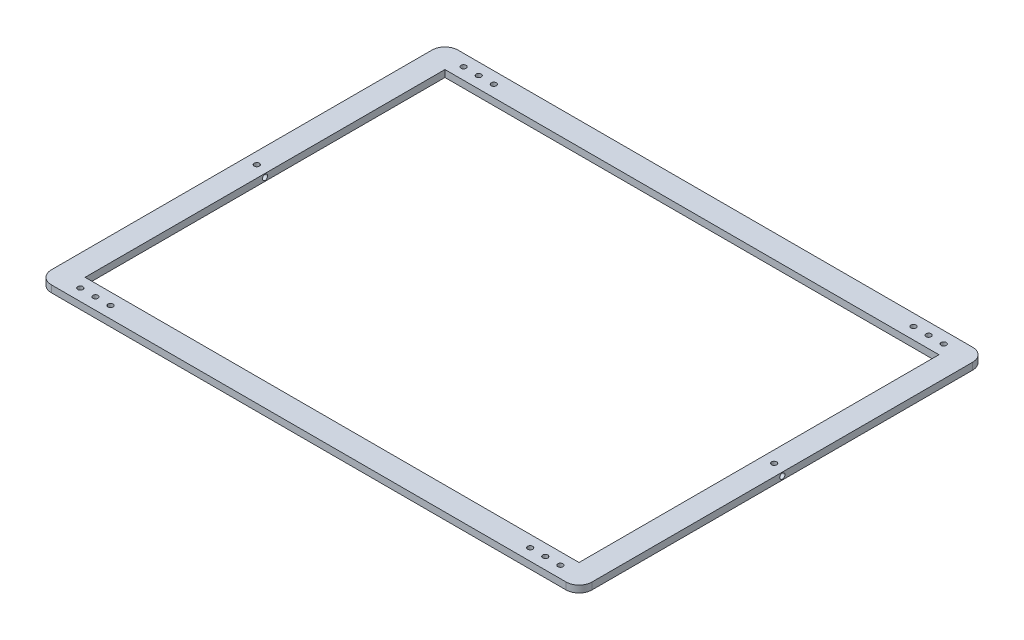
from build123d import *

# Parameters (mm, degrees)
SKETCH_1_W               = 625
SKETCH_1_H               = 470
SKETCH_1_W_2             = 571
SKETCH_1_H_2             = 416
EXTRUDE_1_DEPTH          = 4
FILLET_1_R               = 15
SKETCH_2_R               = 3
CUT_EXTRUDE_1_DEPTH      = 392.082152495
CUT_EXTRUDE_2_DEPTH      = 392.020779499
CUT_EXTRUDE_2_DEPTH_BACK = 392.020779499
SKETCH_3_R               = 3
SKETCH_4_R               = 3
CUT_EXTRUDE_3_DEPTH      = 392.082152495


with BuildPart() as part:
    # Эскиз1 → Бобышка-Вытянуть1 (new, symmetric)
    with BuildSketch(Plane(origin=(0, 0, 0), x_dir=(1, 0, 0), z_dir=(0, 1, 0))):
        Rectangle(SKETCH_1_W, SKETCH_1_H)
        Rectangle(SKETCH_1_W_2, SKETCH_1_H_2, mode=Mode.SUBTRACT)
    extrude(amount=EXTRUDE_1_DEPTH, both=True)

    # Скругление1
    fillet_1_edges = [part.edges().sort_by_distance(p)[0] for p in [
        (312.5, 0, 235),
        (-312.5, 0, 235),
        (312.5, 0, -235),
        (-312.5, 0, -235),
    ]]
    fillet(fillet_1_edges, radius=FILLET_1_R)

    # Эскиз2 → Вырез-Вытянуть1 (cut, through all)
    with BuildSketch(Plane(origin=(0, 4, 0), x_dir=(1, 0, 0), z_dir=(0, 1, 0))):
        with Locations((-277.5, -221.5)):
            Circle(SKETCH_2_R)
        with Locations((-260, -221.5)):
            Circle(SKETCH_2_R)
        with Locations((-242.5, -221.5)):
            Circle(SKETCH_2_R)
        with Locations((242.5, -221.5)):
            Circle(SKETCH_2_R)
        with Locations((260, -221.5)):
            Circle(SKETCH_2_R)
        with Locations((277.5, -221.5)):
            Circle(SKETCH_2_R)
        with Locations((242.5, 221.5)):
            Circle(SKETCH_2_R)
        with Locations((260, 221.5)):
            Circle(SKETCH_2_R)
        with Locations((277.5, 221.5)):
            Circle(SKETCH_2_R)
        with Locations((-277.5, 221.5)):
            Circle(SKETCH_2_R)
        with Locations((-260, 221.5)):
            Circle(SKETCH_2_R)
        with Locations((-242.5, 221.5)):
            Circle(SKETCH_2_R)
    extrude(amount=-CUT_EXTRUDE_1_DEPTH, mode=Mode.SUBTRACT)

    # Эскиз3 → Вырез-Вытянуть2 (cut, two sides: drawn at the far end of the back side and taken through both)
    with BuildSketch(Plane(origin=(0, 0, 0), x_dir=(0, 0, -1), z_dir=(1, 0, 0)).offset(-CUT_EXTRUDE_2_DEPTH_BACK)):
        Circle(SKETCH_3_R)
    extrude(amount=CUT_EXTRUDE_2_DEPTH + CUT_EXTRUDE_2_DEPTH_BACK, mode=Mode.SUBTRACT)

    # Эскиз4 → Вырез-Вытянуть3 (cut, through all)
    with BuildSketch(Plane(origin=(0, 4, 0), x_dir=(1, 0, 0), z_dir=(0, 1, 0))):
        with Locations((-299, 4)):
            Circle(SKETCH_4_R)
        with Locations((299, 4)):
            Circle(SKETCH_4_R)
    extrude(amount=-CUT_EXTRUDE_3_DEPTH, mode=Mode.SUBTRACT)


solid = part.part
